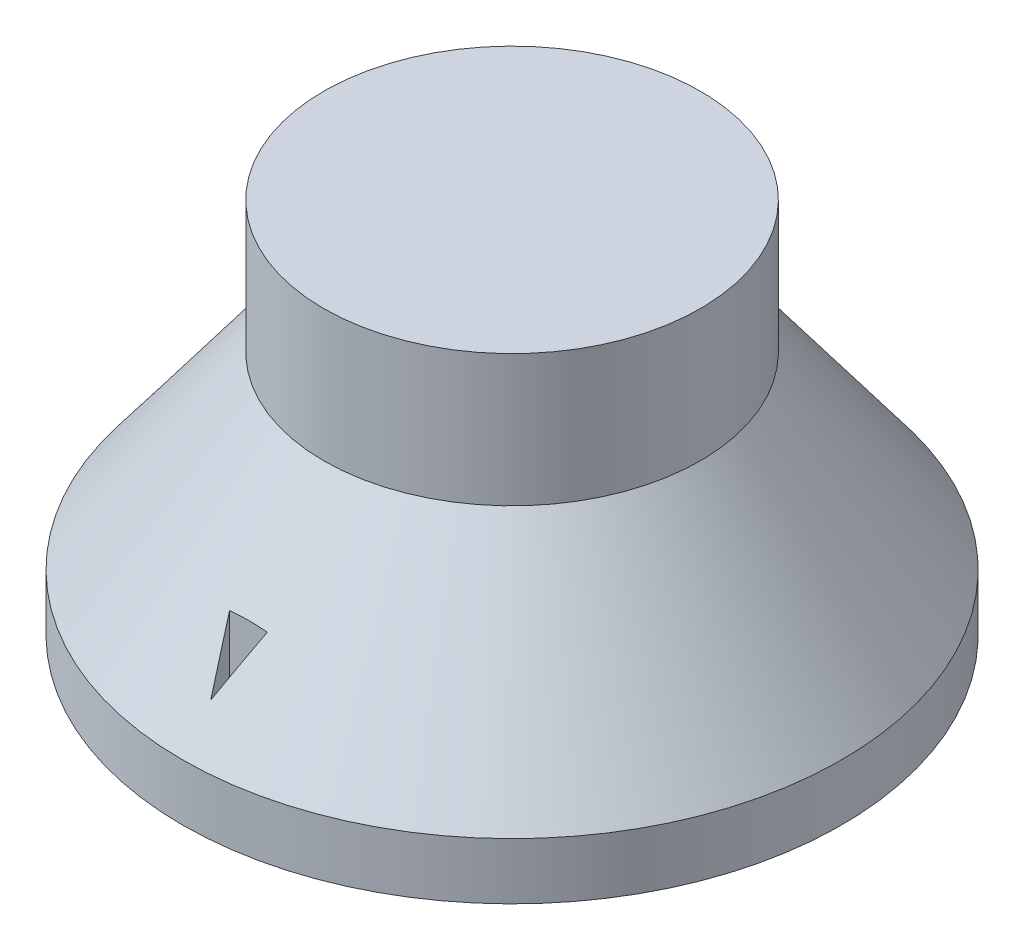
from build123d import *

# Parameters (mm, degrees)
SKETCH1_R                = 12.7
BOSS_EXTRUDE1_DEPTH      = 8.89
SKETCH2_R                = 22.225
BOSS_EXTRUDE3_DEPTH      = 3.81
SKETCH4_R                = 7.62
CUT_EXTRUDE2_DEPTH       = 3.81
BOSS_EXTRUDE4_DEPTH      = 3.81
BOSS_EXTRUDE4_DEPTH_BACK = 6.35
SKETCH7_R                = 3.175
CUT_EXTRUDE3_DEPTH       = 12.7
CUT_EXTRUDE4_DEPTH       = 12.7


with BuildPart() as part:
    # Sketch1 → Boss-Extrude1 (new body)
    with BuildSketch(Plane(origin=(0, 0, 0), x_dir=(1, 0, 0), z_dir=(0, 1, 0))):
        Circle(SKETCH1_R)
    extrude(amount=BOSS_EXTRUDE1_DEPTH)



with BuildPart() as body_2:
    # Sketch2 → Boss-Extrude3 (new body)
    with BuildSketch(Plane(origin=(0, -16.51, 0), x_dir=(1, 0, 0), z_dir=(0, 1, 0))):
        Circle(SKETCH2_R)
    extrude(amount=BOSS_EXTRUDE3_DEPTH)


with BuildPart() as part_1:
    add(part.part)

    add(body_2.part)  # loft2 joins it to this body
    # loft up to a face of the part (loft2)
    loft([Face(Wire([part_1.edges().sort_by_distance((-8.693748245, 0, 9.257901568))[0]])), Face(Wire([part_1.edges().sort_by_distance((-15.214059429, -12.7, -16.201327744))[0]]))])

    # Sketch4 → Cut-Extrude2 (cut)
    with BuildSketch(Plane(origin=(0, -16.51, 0), x_dir=(1, 0, 0), z_dir=(0, 1, 0))):
        Circle(SKETCH4_R)
    extrude(amount=CUT_EXTRUDE2_DEPTH, mode=Mode.SUBTRACT)

    # Sketch3 → Boss-Extrude4 (add, two sides: drawn at the far end of the back side and taken through both)
    with BuildSketch(Plane(origin=(0, -16.51, 0), x_dir=(1, 0, 0), z_dir=(0, 1, 0)).offset(-BOSS_EXTRUDE4_DEPTH_BACK)):
        with BuildLine():
            Line((0, 3.175), (4.779691024, 5.934555899))
            ThreePointArc((4.779691024, 5.934555899), (0, 7.62), (-4.779691024, 5.934555899))
            Line((-4.779691024, 5.934555899), (0, 3.175))
        make_face()
        with BuildLine():
            Line((2.749630657, -1.5875), (2.749630657, -7.106611798))
            ThreePointArc((2.749630657, -7.106611798), (6.599113577, -3.81), (7.529321681, 1.172055899))
            Line((7.529321681, 1.172055899), (2.749630657, -1.5875))
        make_face()
        with BuildLine():
            Line((-2.749630657, -1.5875), (-7.529321681, 1.172055899))
            ThreePointArc((-7.529321681, 1.172055899), (-6.599113577, -3.81), (-2.749630657, -7.106611798))
            Line((-2.749630657, -7.106611798), (-2.749630657, -1.5875))
        make_face()
    extrude(amount=BOSS_EXTRUDE4_DEPTH + BOSS_EXTRUDE4_DEPTH_BACK)

    # Sketch7 → Cut-Extrude3 (cut)
    with BuildSketch(Plane.XZ.offset(12.7)):
        Circle(SKETCH7_R)
    extrude(amount=-CUT_EXTRUDE3_DEPTH, mode=Mode.SUBTRACT)

    # Sketch9 → Cut-Extrude4 (cut)
    with BuildSketch(Plane(origin=(0, 0, 0), x_dir=(1, 0, 0), z_dir=(0, 1, 0))):
        Polygon((0, -20.32), (1.27, -17.78), (-1.27, -17.78), align=None)
    extrude(amount=-CUT_EXTRUDE4_DEPTH, mode=Mode.SUBTRACT)


solid = part_1.part
